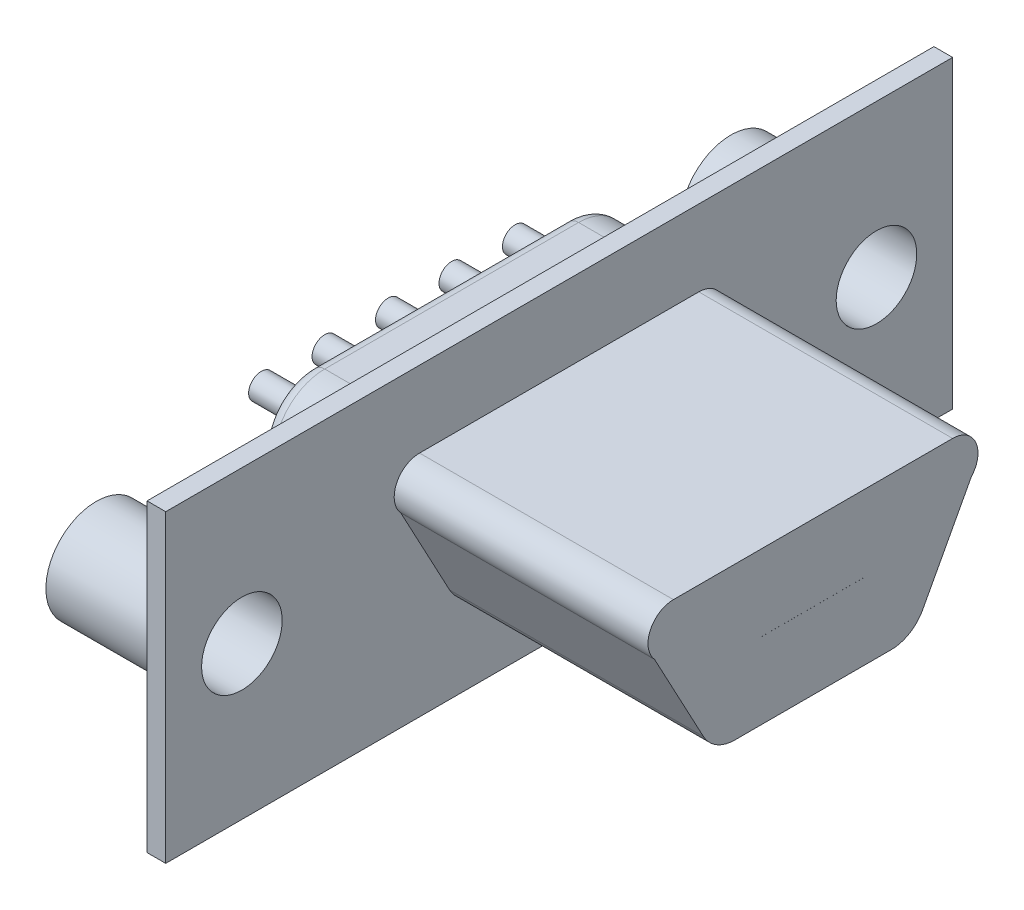
from build123d import *

# Parameters (mm, degrees)
SKETCH1_W                    = 31
SKETCH1_H                    = 12
BASE_FLANGE1_DEPTH           = 0.7366
EXTRUDE_THIN3_DEPTH          = 10
SKETCH8_W                    = 14
SKETCH8_H                    = 7
BOSS_EXTRUDE1_DEPTH          = 4
FILLET2_R                    = 2
FILLET3_R                    = 0.5
SKETCH9_R                    = 0.498553058
BOSS_EXTRUDE2_DEPTH          = 2
SKETCH10_R                   = 0.49857
BOSS_EXTRUDE3_DEPTH          = 2
SKETCH11_R                   = 1.984375
BOSS_EXTRUDE4_DEPTH          = 5
F_1_8_0_125_DIAMETER_HOLE1_D = 3.175


# Sheet-metal steps are written as plain solids
with BuildPart() as part:
    # Sketch1 → Base-Flange1 (new body)
    with BuildSketch(Plane(origin=(0, 0, 0), x_dir=(0, 0, -1), z_dir=(1, 0, 0))):
        Rectangle(SKETCH1_W, SKETCH1_H)
    extrude(amount=-BASE_FLANGE1_DEPTH)

    # Sketch6 → Extrude-Thin3 (add)
    with BuildSketch(Plane(origin=(0, 0, 0), x_dir=(0, 0, -1), z_dir=(1, 0, 0))):
        with BuildLine():
            Line((0, 3), (5.5, 3))
            ThreePointArc((5.5, 3), (6.414535338, 2.404506015), (6.23987009, 1.327250232))
            Line((6.23987009, 1.327250232), (4.317359578, -2.26115081))
            ThreePointArc((4.317359578, -2.26115081), (3.802471809, -2.801168417), (3.083309495, -3))
            Line((3.083309495, -3), (0, -3))
            Line((0, -3), (0, -0.001))
            Line((0, -0.001), (2.125957868, -0.001))
            Line((2.125957868, -0.001), (2.127029382, 0.001))
            Line((2.127029382, 0.001), (0, 0.001))
            Line((0, 0.001), (0, 3))
        make_face()
    extrude_thin3 = extrude(amount=EXTRUDE_THIN3_DEPTH)

    # Mirror1: Extrude-Thin3 across plane
    add(extrude_thin3.mirror(Plane.XY))

    # Sketch8 → Boss-Extrude1 (add)
    with BuildSketch(Plane.ZY.offset(0.7366)):
        Rectangle(SKETCH8_W, SKETCH8_H)
    extrude(amount=BOSS_EXTRUDE1_DEPTH)

    # Fillet2
    fillet2_edges = [part.edges().sort_by_distance(p)[0] for p in [
        (-2.7366, -3.5, 7),
        (-2.7366, 3.5, 7),
        (-2.7366, 3.5, -7),
        (-2.7366, -3.5, -7),
    ]]
    fillet(fillet2_edges, radius=FILLET2_R)

    # Fillet3
    fillet3_edges = [part.edges().sort_by_distance(p)[0] for p in [
        (-4.7366, 0, 7),
        (-4.7366, -3.5, 0),
        (-4.7366, 3.5, 0),
        (-4.7366, 0, -7),
        (-4.7366, 2.914213562, -6.414213562),
        (-4.7366, -2.914213562, -6.414213562),
        (-4.7366, 2.914213562, 6.414213562),
        (-4.7366, -2.914213562, 6.414213562),
    ]]
    fillet(fillet3_edges, radius=FILLET3_R)

    # Sketch9 → Boss-Extrude2 (add)
    with BuildSketch(Plane.ZY.offset(4.7366)):
        with Locations(Location((-5, 1.673069628, 0), (0, 0, 180))):
            Circle(SKETCH9_R)
        with Locations(Location((-2.5, 1.673069628, 0), (0, 0, 180))):
            Circle(SKETCH9_R)
        with Locations(Location((0, 1.673069628, 0), (0, 0, 180))):
            Circle(SKETCH9_R)
        with Locations(Location((2.5, 1.673069628, 0), (0, 0, 180))):
            Circle(SKETCH9_R)
        with Locations(Location((5, 1.673069628, 0), (0, 0, 180))):
            Circle(SKETCH9_R)
    extrude(amount=BOSS_EXTRUDE2_DEPTH)

    # Sketch10 → Boss-Extrude3 (add)
    with BuildSketch(Plane.ZY.offset(4.7366)):
        with Locations(Location((-3.75, -1.115638979, 0), (0, 0, 180))):
            Circle(SKETCH10_R)
        with Locations(Location((-1.25, -1.115638979, 0), (0, 0, 180))):
            Circle(SKETCH10_R)
        with Locations(Location((1.25, -1.115638979, 0), (0, 0, 180))):
            Circle(SKETCH10_R)
        with Locations(Location((3.75, -1.115638979, 0), (0, 0, 180))):
            Circle(SKETCH10_R)
    extrude(amount=BOSS_EXTRUDE3_DEPTH)

    # Sketch11 → Boss-Extrude4 (add)
    with BuildSketch(Plane.ZY.offset(0.7366)):
        with Locations((-12.5, 0)):
            Circle(SKETCH11_R)
    boss_extrude4 = extrude(amount=BOSS_EXTRUDE4_DEPTH)

    # Mirror2: Boss-Extrude4 across plane
    add(boss_extrude4.mirror(Plane.XY))

    # 1/8 (0.125) Diameter Hole1 (through all)
    with Locations(Plane.ZY.offset(5.7366)):
        with Locations((-12.5, 0)):
            f_1_8_0_125_diameter_hole1 = Hole(F_1_8_0_125_DIAMETER_HOLE1_D / 2)

    # Mirror3: 1/8 (0.125) Diameter Hole1 across plane
    add(f_1_8_0_125_diameter_hole1.mirror(Plane.XY), mode=Mode.SUBTRACT)


solid = part.part
